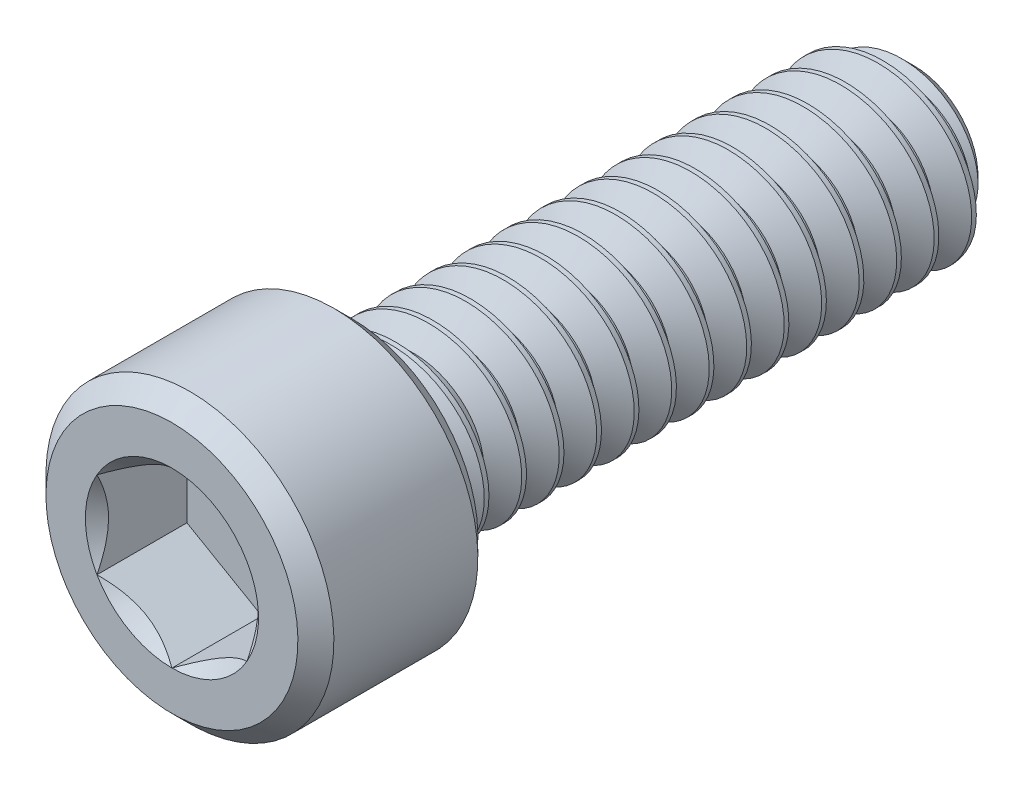
from build123d import *

# Parameters (mm, degrees)
CUT_EXTRUDE1_DEPTH = 0.762
CUT_SWEEP1_PITCH   = 0.3175
CUT_SWEEP1_TO      = 4.7625


with BuildPart() as part:
    # Sketch3 → Revolve1 (revolve)
    with BuildSketch(Plane(origin=(0, 0, 0), x_dir=(0, 0, -1), z_dir=(1, 0, 0))):
        Polygon((3.14325, 0), (-3.14325, 0), (-3.14325, 1.0668), (-2.99085, 1.2192), (-1.77165, 1.2192), (-1.61925, 1.0668), (-1.61925, 0.762), (2.921, 0.762), (3.14325, 0.53975), align=None)
    revolve(axis=Axis((0, 0, -3.14325), (0, 0, 1)))

    # Sketch4 → Cut-Extrude1 (cut)
    with BuildSketch(Plane.XY.offset(3.14325)):
        Polygon((0, -0.733234842), (0.635, -0.366617421), (0.635, 0.366617421), (0, 0.733234842), (-0.635, 0.366617421), (-0.635, -0.366617421), align=None)
    extrude(amount=-CUT_EXTRUDE1_DEPTH, mode=Mode.SUBTRACT)

    # Cut-Extrude3 cone 1 section (through the dimple's axis) → Cut-Extrude3 (revolve, cut)
    with BuildSketch(Plane(origin=(0, 0, 3.14325), x_dir=(0, -1, 0), z_dir=(1, 0, 0))):
        Polygon((0, 0), (0.733234842, 0), (0, 0.733234842), align=None)
    revolve(axis=Axis((0, 0, 3.14325), (0, 0, -1)), mode=Mode.SUBTRACT)


with BuildPart() as body_2:
    # Split1: read off the stored shape, not the designer's step
    # Split1: the piece on the far side of the plane
    add(part.part)
    split(bisect_by=Plane.XY.offset(1.61925), keep=Keep.BOTTOM)

    # Cut-Sweep1: arcs per turn and ends read off the stored shape
    # Cut-Sweep1: the profile of Sketch7 screwed along a right-hand helix through 16 turns, 6 arcs to a turn; built about Z, then put on its axis
    cut_sweep1_z = Axis((0, 0, 0), (0, 0, 1))
    cut_sweep1_corners = [(0.779185192, 0, 0.009921875), (0.779185192, 0, -0.287734375), (0.555777701, 0, -0.15875), (0.555777701, 0, -0.1190625)]
    with BuildLine(mode=Mode.PRIVATE) as cut_sweep1_profile:
        Line(cut_sweep1_corners[0], cut_sweep1_corners[1])
        Line(cut_sweep1_corners[1], cut_sweep1_corners[2])
        Line(cut_sweep1_corners[2], cut_sweep1_corners[3])
        Line(cut_sweep1_corners[3], cut_sweep1_corners[0])
    cut_sweep1_cap = Face(cut_sweep1_profile.wire())
    cut_sweep1_turn_angles = [0, 30, 60, 90, 120, 150, 180, 210, 240, 270, 300, 330, 360]
    cut_sweep1_turn_weights = [1, 0.8660254037844387, 1, 0.8660254037844387, 1, 0.8660254037844387, 1, 0.8660254037844387, 1, 0.8660254037844387, 1, 0.8660254037844387, 1]
    cut_sweep1_turn_rails = [Edge.make_bspline([Vector(p[0], p[1], 0).rotate(cut_sweep1_z, cut_sweep1_turn_angles[k]) / cut_sweep1_turn_weights[k] + Vector(0, 0, p[2] + CUT_SWEEP1_PITCH * cut_sweep1_turn_angles[k] / 360) for k in range(13)], [0, 0, 0, 1, 1, 2, 2, 3, 3, 4, 4, 5, 5, 6, 6, 6], 2, cut_sweep1_turn_weights) for p in cut_sweep1_corners]
    cut_sweep1_turn_sides = [Face.make_surface_from_curves(cut_sweep1_turn_rails[p[0]], cut_sweep1_turn_rails[p[1]]) for p in [(0, 1), (1, 2), (2, 3), (3, 0)]]
    cut_sweep1 = Plane(origin=(0, 0, -3.14325), x_dir=(0, 1, 0), z_dir=(0, 0, 1)) * split(Solid(Shell([*[p.moved(Location((0, 0, CUT_SWEEP1_PITCH * i))) for i in range(16) for p in cut_sweep1_turn_sides], cut_sweep1_cap, cut_sweep1_cap.rotate(cut_sweep1_z, 5760).moved(Location((0, 0, CUT_SWEEP1_PITCH * 5760 / 360)))])), bisect_by=Plane.XY.offset(CUT_SWEEP1_TO), keep=Keep.BOTTOM, mode=Mode.PRIVATE)
    add(cut_sweep1, mode=Mode.SUBTRACT)


with BuildPart() as part_1:
    add(part.part)

    # Split1
    split(bisect_by=Plane.XY.offset(1.61925), keep=Keep.TOP)

    add(body_2.part)  # Boss-Extrude1 merges body 2
    # Boss-Extrude1: read off the stored shape, not the designer's step
    # Boss-Extrude1 outline → Boss-Extrude1 (revolve)
    with BuildSketch(Plane.XZ):
        Polygon((0.555776773, 1.61925), (0.555776773, 1.052656339), (0.762, 1.61925), align=None)
    revolve(axis=Axis((0, 0, 0), (0, 0, 1)))


solid = part_1.part
